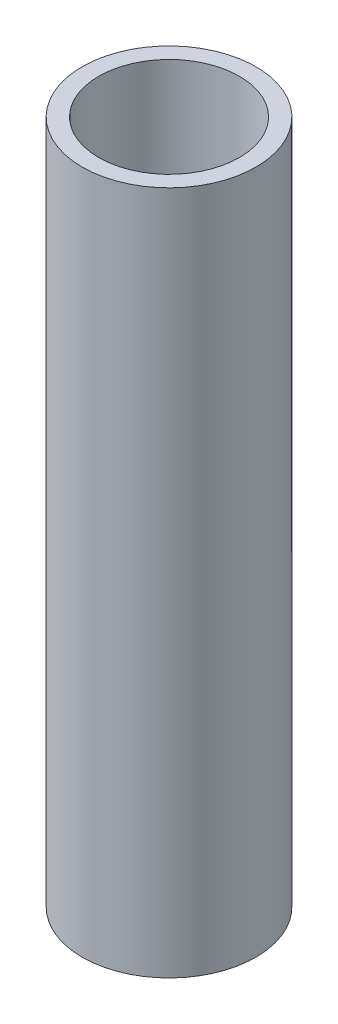
from build123d import *

# Parameters (mm, degrees)
SKETCH1_R           = 12.7
SKETCH1_R_2         = 10.287
BOSS_EXTRUDE1_DEPTH = 100


with BuildPart() as part:
    # Sketch1 → Boss-Extrude1 (new body)
    with BuildSketch(Plane(origin=(0, 0, 0), x_dir=(1, 0, 0), z_dir=(0, 1, 0))):
        Circle(SKETCH1_R)
        Circle(SKETCH1_R_2, mode=Mode.SUBTRACT)
    extrude(amount=BOSS_EXTRUDE1_DEPTH)


solid = part.part
